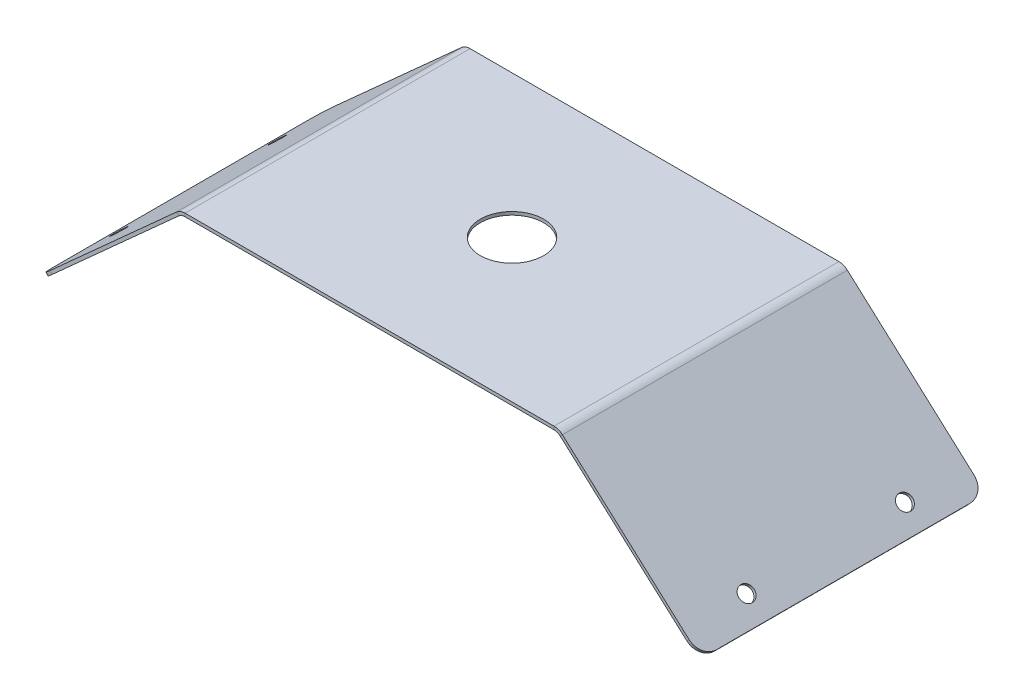
from build123d import *

# Parameters (mm, degrees)
ESBO_O1_W                 = 116.5
ESBO_O1_H                 = 90
FLANGE_BASE1_DEPTH        = 1
ARESTA_FLANGE1_DEPTH      = 90
ARESTA_FLANGE1_BEND_DEPTH = 90
CORTE_EXTRUS_O1_REACH     = 157.954
ESBO_O12_R                = 2.4
FILETE1_R                 = 5
CORTE_EXTRUS_O2_REACH     = 123.127
ESBO_O13_R                = 10


# Sheet-metal steps are written as plain solids
with BuildPart() as part:
    # Esboço1 → Flange-base1 (new body)
    with BuildSketch(Plane(origin=(0, 0, 0), x_dir=(1, 0, 0), z_dir=(0, 1, 0))):
        Rectangle(ESBO_O1_W, ESBO_O1_H)
    extrude(amount=-FLANGE_BASE1_DEPTH)

    # Aresta-Flange1 section (across the edge) → Aresta-Flange1 (add)
    with BuildSketch(Plane(origin=(59.401592105, -1, -45), x_dir=(-0.6691306063588541, -0.7431448254773979, 0), z_dir=(0, 0, 1))):
        with BuildLine():
            Line((-1, 1.151592105), (-1, 60))
            Line((-1, 60), (0, 60))
            Line((0, 60), (0, 1.151592105))
            ThreePointArc((0, 1.151592105), (0.199258721, 0.076488256), (0.770565524, -0.855799714))
            Line((0.770565524, -0.855799714), (0.027420698, -1.52493032))
            ThreePointArc((0.027420698, -1.52493032), (-0.734321706, -0.281879693), (-1, 1.151592105))
        make_face()
    extrude(amount=ARESTA_FLANGE1_DEPTH)

    # Aresta-Flange1 section 2 (across the edge) → Aresta-Flange1 bend (add)
    with BuildSketch(Plane(origin=(-59.401592105, -1, 45), x_dir=(0.6691306063588541, -0.7431448254773979, 0), z_dir=(0, 0, -1))):
        with BuildLine():
            Line((-1, 1.151592105), (-1, 60))
            Line((-1, 60), (0, 60))
            Line((0, 60), (0, 1.151592105))
            ThreePointArc((0, 1.151592105), (0.199258721, 0.076488256), (0.770565524, -0.855799714))
            Line((0.770565524, -0.855799714), (0.027420698, -1.52493032))
            ThreePointArc((0.027420698, -1.52493032), (-0.734321706, -0.281879693), (-1, 1.151592105))
        make_face()
    extrude(amount=ARESTA_FLANGE1_BEND_DEPTH)

    # Esboço12 → Corte-extrusão1 (cut, up to next)
    with BuildSketch(Plane(origin=(26.768087142, 29.728972578, 0), x_dir=(0.7431448254773978, -0.6691306063588544, 0), z_dir=(0.6691306063588544, 0.7431448254773978, 0)), mode=Mode.PRIVATE) as corte_extrus_o1_sk1:
        with Locations(Location((97.313116404, -25, 0), (0, 0, 180))):
            Circle(ESBO_O12_R)
    corte_extrus_o1_tool1 = extrude(corte_extrus_o1_sk1.sketch, amount=-CORTE_EXTRUS_O1_REACH, mode=Mode.PRIVATE) & part.part
    # Esboço12 → Corte-extrusão1 (cut, up to next)
    with BuildSketch(Plane(origin=(26.768087142, 29.728972578, 0), x_dir=(0.7431448254773978, -0.6691306063588544, 0), z_dir=(0.6691306063588544, 0.7431448254773978, 0)), mode=Mode.PRIVATE) as corte_extrus_o1_sk2:
        with Locations(Location((97.313116404, 25, 0), (0, 0, 180))):
            Circle(ESBO_O12_R)
    corte_extrus_o1_tool2 = extrude(corte_extrus_o1_sk2.sketch, amount=-CORTE_EXTRUS_O1_REACH, mode=Mode.PRIVATE) & part.part
    corte_extrus_o1_1 = corte_extrus_o1_tool1.solids().sort_by_distance((99.085826, -35.386212, 25))[0]
    add(corte_extrus_o1_1, mode=Mode.SUBTRACT)
    corte_extrus_o1_2 = corte_extrus_o1_tool2.solids().sort_by_distance((99.085826, -35.386212, -25))[0]
    add(corte_extrus_o1_2, mode=Mode.SUBTRACT)
    corte_extrus_o1 = corte_extrus_o1_1 + corte_extrus_o1_2  # Corte-extrusão1 as one shape, for the pattern or mirror that repeats it

    # Espelhar1: Corte-extrusão1 across plane
    add(corte_extrus_o1.mirror(Plane(origin=(0, 0, 0), x_dir=(0, 0, 1), z_dir=(1, 0, 0))), mode=Mode.SUBTRACT)

    # Filete1
    filete1_edges = [part.edges().sort_by_distance(p)[0] for p in [
        (104.324846937, -40.776263969, -45),
        (104.324846937, -40.776263969, 45),
        (-104.324846937, -40.776263969, 45),
        (-104.324846937, -40.776263969, -45),
    ]]
    fillet(filete1_edges, radius=FILETE1_R)

    # Esboço13 → Corte-extrusão2 (cut, up to next)
    with BuildSketch(Plane(origin=(0, 0, 0), x_dir=(1, 0, 0), z_dir=(0, 1, 0)), mode=Mode.PRIVATE) as corte_extrus_o2_sk1:
        with Locations(Location((0, 0, 0), (0, 0, 270))):
            Circle(ESBO_O13_R)
    corte_extrus_o2_tool1 = extrude(corte_extrus_o2_sk1.sketch, amount=-CORTE_EXTRUS_O2_REACH, mode=Mode.PRIVATE) & part.part
    add(corte_extrus_o2_tool1.solids().sort_by_distance((0, 0, 0))[0], mode=Mode.SUBTRACT)


solid = part.part
